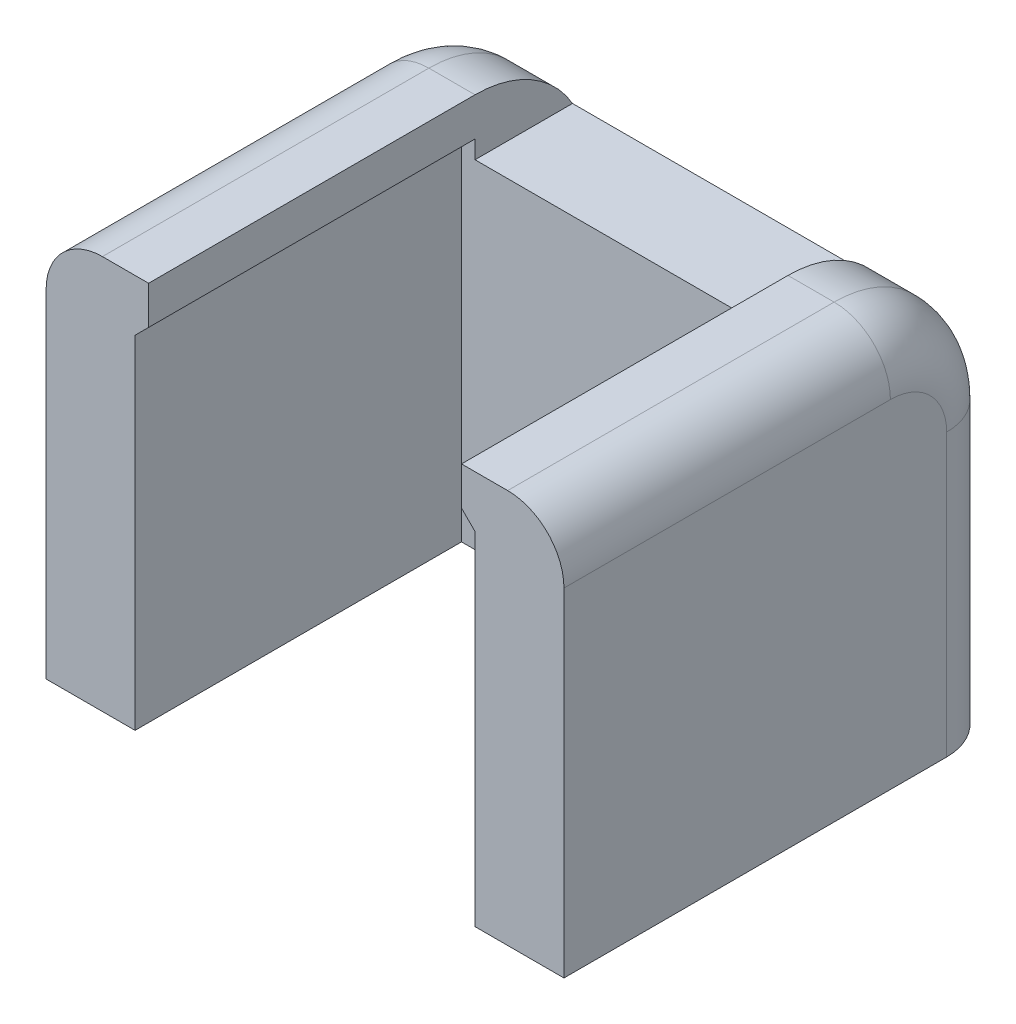
from build123d import *

# Parameters (mm, degrees)
SKETCH_1_W                   = 46
SKETCH_1_H                   = 35
EXTRUDE_1_DEPTH              = 39
SKETCH_2_W                   = 30.2
SKETCH_2_H                   = 30
CUT_EXTRUDE_1_DEPTH          = 29
SKETCH_4_W                   = 27.8
SKETCH_4_H                   = 10
CUT_EXTRUDE_2_DEPTH          = 49.541219597
HOLE_WIZARD_M6_2_D           = 6.5
HOLE_WIZARD_M6_2_CBORE_D     = 11
HOLE_WIZARD_M6_2_CBORE_DEPTH = 5
CHAMFER_1_SIZE               = 1.6
FILLET_3_R                   = 10
FILLET_4_R                   = 5


with BuildPart() as part:
    # 草图1 → 凸台-拉伸1 (new body)
    with BuildSketch(Plane.XY):
        Rectangle(SKETCH_1_W, SKETCH_1_H)
    extrude(amount=EXTRUDE_1_DEPTH)

    # 草图2 → 切除-拉伸1 (cut)
    with BuildSketch(Plane.XY.offset(39)):
        with Locations((0, -2.5)):
            Rectangle(SKETCH_2_W, SKETCH_2_H)
    extrude(amount=-CUT_EXTRUDE_1_DEPTH, mode=Mode.SUBTRACT)

    # 草图4 → 切除-拉伸2 (cut, through all)
    with BuildSketch(Plane.XY.offset(39)):
        with Locations((0, 17.5)):
            Rectangle(SKETCH_4_W, SKETCH_4_H)
    extrude(amount=-CUT_EXTRUDE_2_DEPTH, mode=Mode.SUBTRACT)

    # M6 凹头盖螺钉的柱形沉头孔2 (through all)
    with Locations(Plane(origin=(0, 0, 0), x_dir=(-1, 0, 0), z_dir=(0, 0, -1))):
        with Locations((0, -2.5)):
            CounterBoreHole(HOLE_WIZARD_M6_2_D / 2, HOLE_WIZARD_M6_2_CBORE_D / 2, HOLE_WIZARD_M6_2_CBORE_DEPTH)

    # 倒角1
    # the kernel refuses this chamfer: 1.6 mm, written as the material it takes off along each edge
    with BuildSketch(Plane(origin=(13.9, 12.5, 43.114692781), x_dir=(-0.027495876610586285, 0.9996219169112968, 0), z_dir=(0, 0, -1))) as chamfer_1_piece_1_section:
        Polygon((CHAMFER_1_SIZE * 0.999621916911, CHAMFER_1_SIZE * 0.0274958766106), (-CHAMFER_1_SIZE * 0.0274958766106, CHAMFER_1_SIZE * 0.999621916911), (0, 0), align=None)
    chamfer_1_piece_1 = extrude(amount=33.114692781, mode=Mode.PRIVATE)
    chamfer_1_piece_1 = split(chamfer_1_piece_1, bisect_by=Plane(origin=(15.1, 13.06, 24.5), z_dir=(-1, 0, 0)), keep=Keep.TOP, mode=Mode.PRIVATE)
    add(chamfer_1_piece_1, mode=Mode.SUBTRACT)
    with BuildSketch(Plane(origin=(-13.9, 12.5, 43.114692781), x_dir=(0.027495876610586285, 0.9996219169112968, 0), z_dir=(0, 0, -1))) as chamfer_1_piece_2_section:
        Polygon((CHAMFER_1_SIZE * 0.999621916911, -CHAMFER_1_SIZE * 0.0274958766106), (-CHAMFER_1_SIZE * 0.0274958766106, -CHAMFER_1_SIZE * 0.999621916911), (0, 0), align=None)
    chamfer_1_piece_2 = extrude(amount=33.114692781, mode=Mode.PRIVATE)
    chamfer_1_piece_2 = split(chamfer_1_piece_2, bisect_by=Plane(origin=(-15.1, 13.06, 24.5), z_dir=(1, 0, 0)), keep=Keep.TOP, mode=Mode.PRIVATE)
    add(chamfer_1_piece_2, mode=Mode.SUBTRACT)

    # 圆角3
    fillet_3_edges = [part.edges().sort_by_distance(p)[0] for p in [
        (18.45, 17.5, 0),
    ]]
    fillet(fillet_3_edges, radius=FILLET_3_R)

    # 圆角4
    fillet_4_edges = [part.edges().sort_by_distance(p)[0] for p in [
        (23, -5, 0),
        (-23, 17.5, 24.499999812),
        (23, 17.5, 24.5),
        (-23, -5, 0),
        (-23, 14.571067679, 2.928932055),
        (23, 14.571067812, 2.928932188),
    ]]
    fillet(fillet_4_edges, radius=FILLET_4_R)


solid = part.part
